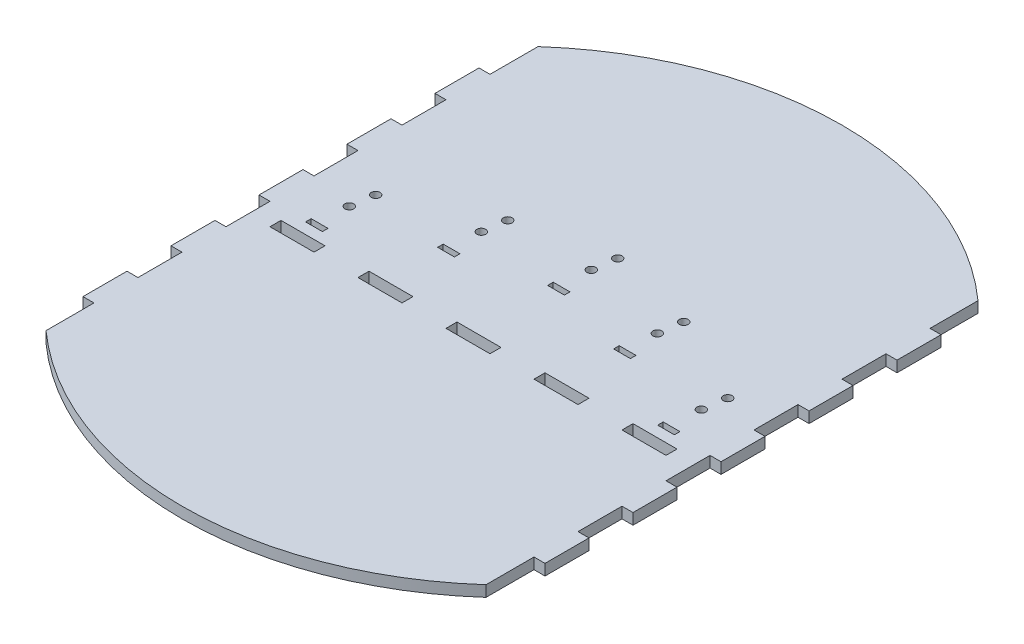
from build123d import *

# Parameters (mm, degrees)
SKICA1_R                = 2
SKICA1_W                = 7.62
SKICA1_H                = 2.54
SKICA1_W_2              = 20
SKICA1_H_2              = 5
P_IDAT_VYSUNUT_M1_DEPTH = 5


with BuildPart() as part:
    # Skica1 → Přidat vysunutím1 (new body)
    with BuildSketch(Plane(origin=(0, 0, 0), x_dir=(1, 0, 0), z_dir=(0, 1, 0))):
        with BuildLine():
            Line((-105, 10), (-105, -10))
            Line((-105, -10), (-100, -10))
            Line((-100, -10), (-100, -30))
            Line((-100, -30), (-105, -30))
            Line((-105, -30), (-105, -50))
            Line((-105, -50), (-100, -50))
            Line((-100, -50), (-100, -70))
            Line((-100, -70), (-105, -70))
            Line((-105, -70), (-105, -90))
            Line((-105, -90), (-100, -90))
            Line((-100, -90), (-100, -111.803398875))
            ThreePointArc((-100, -111.803398875), (0, -150), (100, -111.803398875))
            Line((100, -111.803398875), (100, -90))
            Line((100, -90), (105, -90))
            Line((105, -90), (105, -70))
            Line((105, -70), (100, -70))
            Line((100, -70), (100, -50))
            Line((100, -50), (105, -50))
            Line((105, -50), (105, -30))
            Line((105, -30), (100, -30))
            Line((100, -30), (100, -10))
            Line((100, -10), (105, -10))
            Line((105, -10), (105, 10))
            Line((105, 10), (100, 10))
            Line((100, 10), (100, 30))
            Line((100, 30), (105, 30))
            Line((105, 30), (105, 50))
            Line((105, 50), (100, 50))
            Line((100, 50), (100, 70))
            Line((100, 70), (105, 70))
            Line((105, 70), (105, 90))
            Line((105, 90), (100, 90))
            Line((100, 90), (100, 111.803398875))
            ThreePointArc((100, 111.803398875), (0, 150), (-100, 111.803398875))
            Line((-100, 111.803398875), (-100, 90))
            Line((-100, 90), (-105, 90))
            Line((-105, 90), (-105, 70))
            Line((-105, 70), (-100, 70))
            Line((-100, 70), (-100, 50))
            Line((-100, 50), (-105, 50))
            Line((-105, 50), (-105, 30))
            Line((-105, 30), (-100, 30))
            Line((-100, 30), (-100, 10))
            Line((-100, 10), (-105, 10))
        make_face()
        with Locations((1.5, 46.54)):
            Circle(SKICA1_R, mode=Mode.SUBTRACT)
        with Locations((0, 36.04)):
            Circle(SKICA1_R, mode=Mode.SUBTRACT)
        with Locations((0, 21.27)):
            Rectangle(SKICA1_W, SKICA1_H, mode=Mode.SUBTRACT)
        with Locations((-80, 6.04)):
            Circle(SKICA1_R, mode=Mode.SUBTRACT)
        with Locations((-78.5, 16.54)):
            Circle(SKICA1_R, mode=Mode.SUBTRACT)
        Polygon((-36.19, 10), (-43.81, 10), (-43.81, 12.54), (-40, 12.54), (-36.19, 12.54), align=None, mode=Mode.SUBTRACT)
        with Locations((-40, 26.04)):
            Circle(SKICA1_R, mode=Mode.SUBTRACT)
        with Locations((-38.5, 36.54)):
            Circle(SKICA1_R, mode=Mode.SUBTRACT)
        with Locations((80, 6.04)):
            Circle(SKICA1_R, mode=Mode.SUBTRACT)
        with Locations((81.5, 16.54)):
            Circle(SKICA1_R, mode=Mode.SUBTRACT)
        Polygon((43.81, 12.54), (43.81, 10), (36.19, 10), (36.19, 12.54), (40, 12.54), align=None, mode=Mode.SUBTRACT)
        with Locations((40, 26.04)):
            Circle(SKICA1_R, mode=Mode.SUBTRACT)
        with Locations((41.5, 36.54)):
            Circle(SKICA1_R, mode=Mode.SUBTRACT)
        Polygon((-80, -7.46), (-76.19, -7.46), (-76.19, -10), (-83.81, -10), (-83.81, -7.46), align=None, mode=Mode.SUBTRACT)
        with Locations((0, -17.5)):
            Rectangle(SKICA1_W_2, SKICA1_H_2, mode=Mode.SUBTRACT)
        with Locations((-40, -17.5)):
            Rectangle(SKICA1_W_2, SKICA1_H_2, mode=Mode.SUBTRACT)
        with Locations((-80, -17.5)):
            Rectangle(SKICA1_W_2, SKICA1_H_2, mode=Mode.SUBTRACT)
        Polygon((80, -7.46), (83.81, -7.46), (83.81, -10), (76.19, -10), (76.19, -7.46), align=None, mode=Mode.SUBTRACT)
        with Locations((80, -17.5)):
            Rectangle(SKICA1_W_2, SKICA1_H_2, mode=Mode.SUBTRACT)
        with Locations((40, -17.5)):
            Rectangle(SKICA1_W_2, SKICA1_H_2, mode=Mode.SUBTRACT)
    extrude(amount=P_IDAT_VYSUNUT_M1_DEPTH)


solid = part.part
